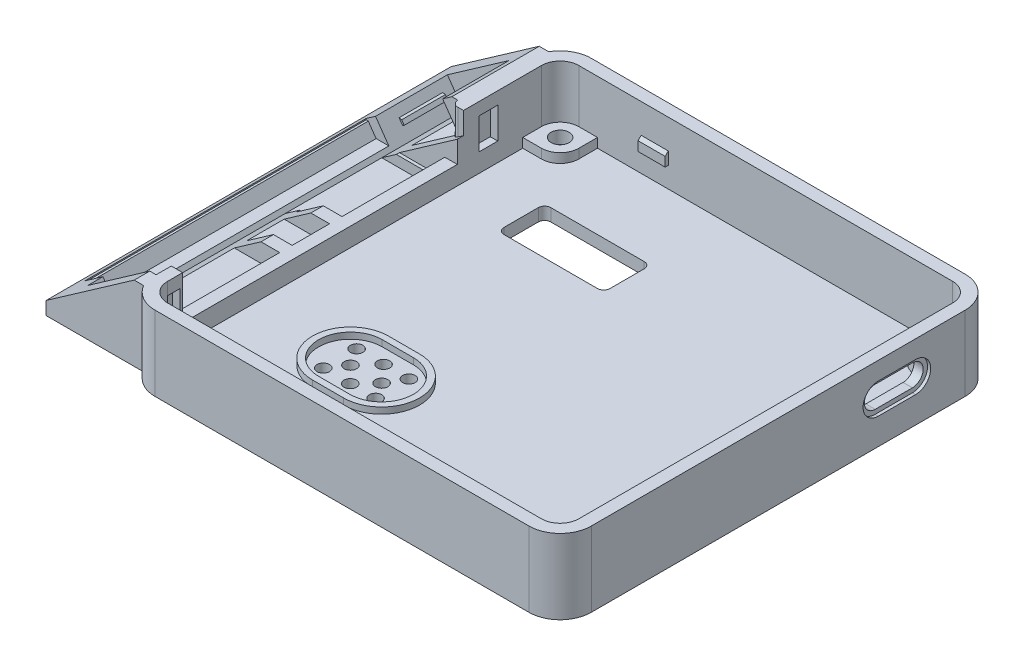
from build123d import *

# Parameters (mm, degrees)
EXTRUDE_1_DEPTH                 = 2
EXTRUDE_2_DEPTH                 = 10
SKETCH_3_W                      = 2
SKETCH_3_H                      = 60
CUT_EXTRUDE_1_DEPTH             = 7
EXTRUDE_3_DEPTH                 = 1.5
SKETCH_5_R                      = 1.45
CUT_EXTRUDE_2_DEPTH             = 2
SKETCH_6_W                      = 15
SKETCH_6_H                      = 60
EXTRUDE_4_DEPTH                 = 1
CUT_EXTRUDE_3_DEPTH             = 4
CUT_EXTRUDE_4_DEPTH             = 0.5
SKETCH_10_W                     = 1.3
SKETCH_10_H                     = 60
EXTRUDE_5_DEPTH                 = 2
EXTRUDE_6_DEPTH                 = 60
CUT_EXTRUDE_5_REACH             = 84.879
CUT_EXTRUDE_5_DIRECTION_2_DEPTH = 83.8794305
SKETCH_13_W                     = 9.618455624
SKETCH_13_H                     = 12
SKETCH_13_H_2                   = 9.5
CUT_EXTRUDE_6_DEPTH             = 3
SKETCH_14_W                     = 2.5
SKETCH_14_H                     = 12
EXTRUDE_7_DEPTH                 = 16
CUT_EXTRUDE_7_DEPTH             = 56
CUT_EXTRUDE_8_DEPTH             = 9
CUT_EXTRUDE_9_REACH             = 86.854
EXTRUDE_11_REACH                = 69.777
SKETCH_18_W                     = 3.617665378
SKETCH_18_H                     = 2.486750252
SKETCH_18_W_2                   = 13.966175107
SKETCH_18_H_2                   = 1.144037097
SKETCH_20_W                     = 1.83009778
SKETCH_20_H                     = 2.431652405
EXTRUDE_12_DEPTH                = 7
SKETCH_21_W                     = 31.175621826
SKETCH_21_H                     = 21.420158012
CUT_EXTRUDE_10_DEPTH            = 65
EXTRUDE_14_REACH                = 69.777
SKETCH_22_W                     = 2.262350427
SKETCH_22_H                     = 11.841336359
EXTRUDE_15_DEPTH                = 2
EXTRUDE_START                   = -30
EXTRUDE_16_DEPTH                = 11.523748541
SKETCH_25_W                     = 9.173589302
SKETCH_25_H                     = 3.581253289
CUT_EXTRUDE_11_DEPTH            = 18
EXTRUDE_17_DEPTH                = 1.115472511
SKETCH_27_W                     = 3
SKETCH_27_H                     = 5
CUT_EXTRUDE_12_DEPTH            = 1.2
SKETCH_29_W                     = 3
SKETCH_29_H                     = 5
SKETCH_29_W_2                   = 2
CUT_EXTRUDE_13_DEPTH            = 1.2
SKETCH_30_W                     = 7.618455624
SKETCH_30_H                     = 15.5
CUT_EXTRUDE_14_DEPTH            = 1.634293
EXTRUDE_18_DEPTH                = 2
CUT_EXTRUDE_15_DEPTH            = 7
SKETCH_33_W                     = 4.353731563
SKETCH_33_H                     = 2
EXTRUDE_19_DEPTH                = 0.5
CHAMFER_1_SIZE                  = 0.5
SKETCH_34_W                     = 5.726465504
SKETCH_34_H                     = 2
EXTRUDE_20_DEPTH                = 0.5
CHAMFER_2_SIZE                  = 0.5
SKETCH_35_W                     = 17
SKETCH_35_H                     = 7.5
CUT_EXTRUDE_16_DEPTH            = 2
EXTRUDE_21_DEPTH                = 1
SKETCH_37_R                     = 1
CUT_EXTRUDE_17_DEPTH            = 2
FILLET_1_R                      = 1
SKETCH_38_W                     = 7
SKETCH_38_H                     = 1
EXTRUDE_22_DEPTH                = 0.3
SKETCH_39_W                     = 7
SKETCH_39_H                     = 1
EXTRUDE_23_DEPTH                = 0.3
CHAMFER_3_SIZE                  = 0.3


# Read off the part's stored shape, not the designer's step: 凸台-拉伸16
with BuildPart() as part:
    # 草图1 → 凸台-拉伸1 (new body)
    with BuildSketch(Plane(origin=(0, 0, 0), x_dir=(1, 0, 0), z_dir=(0, 1, 0))):
        with BuildLine():
            Line((-30, -35), (30, -35))
            ThreePointArc((30, -35), (33.535533906, -33.535533906), (35, -30))
            Line((35, -30), (35, 30))
            ThreePointArc((35, 30), (33.535533906, 33.535533906), (30, 35))
            Line((30, 35), (-30, 35))
            ThreePointArc((-30, 35), (-33.535533906, 33.535533906), (-35, 30))
            Line((-35, 30), (-35, -30))
            ThreePointArc((-35, -30), (-33.535533906, -33.535533906), (-30, -35))
        make_face()
    extrude(amount=EXTRUDE_1_DEPTH)

    # 草图2 → 凸台-拉伸2 (add)
    with BuildSketch(Plane(origin=(0, 2, 0), x_dir=(1, 0, 0), z_dir=(0, 1, 0))):
        with BuildLine():
            Line((-30, -35), (30, -35))
            ThreePointArc((30, -35), (33.535533906, -33.535533906), (35, -30))
            Line((35, -30), (35, 30))
            ThreePointArc((35, 30), (33.535533906, 33.535533906), (30, 35))
            Line((30, 35), (-30, 35))
            ThreePointArc((-30, 35), (-33.535533906, 33.535533906), (-35, 30))
            Line((-35, 30), (-35, -30))
            ThreePointArc((-35, -30), (-33.535533906, -33.535533906), (-30, -35))
        make_face()
        with BuildLine():
            Line((-33, -30), (-33, 30))
            ThreePointArc((-33, 30), (-32.121320344, 32.121320344), (-30, 33))
            Line((-30, 33), (30, 33))
            ThreePointArc((30, 33), (32.121320344, 32.121320344), (33, 30))
            Line((33, 30), (33, -30))
            ThreePointArc((33, -30), (32.121320344, -32.121320344), (30, -33))
            Line((30, -33), (-30, -33))
            ThreePointArc((-30, -33), (-32.121320344, -32.121320344), (-33, -30))
        make_face(mode=Mode.SUBTRACT)
    extrude(amount=EXTRUDE_2_DEPTH)

    # 草图3 → 切除-拉伸1 (cut)
    with BuildSketch(Plane(origin=(0, 12, 0), x_dir=(1, 0, 0), z_dir=(0, 1, 0))):
        with Locations((-34, 0)):
            Rectangle(SKETCH_3_W, SKETCH_3_H)
    extrude(amount=-CUT_EXTRUDE_1_DEPTH, mode=Mode.SUBTRACT)

    # 草图4 → 凸台-拉伸3 (add)
    with BuildSketch(Plane(origin=(0, 2, 0), x_dir=(1, 0, 0), z_dir=(0, 1, 0))):
        with BuildLine():
            Line((-27, 30), (-27, 33))
            Line((-27, 33), (-30, 33))
            ThreePointArc((-30, 33), (-32.121320344, 32.121320344), (-33, 30))
            Line((-33, 30), (-33, 27))
            Line((-33, 27), (-30, 27))
            ThreePointArc((-30, 27), (-27.878679656, 27.878679656), (-27, 30))
        make_face()
        with BuildLine():
            Line((27, 30), (27, 33))
            Line((27, 33), (30, 33))
            ThreePointArc((30, 33), (32.121320344, 32.121320344), (33, 30))
            Line((33, 30), (33, 27))
            Line((33, 27), (30, 27))
            ThreePointArc((30, 27), (27.878679656, 27.878679656), (27, 30))
        make_face()
        with BuildLine():
            Line((-33, -27), (-33, -30))
            ThreePointArc((-33, -30), (-32.121320344, -32.121320344), (-30, -33))
            Line((-30, -33), (-27, -33))
            Line((-27, -33), (-27, -30))
            ThreePointArc((-27, -30), (-27.878679656, -27.878679656), (-30, -27))
            Line((-30, -27), (-33, -27))
        make_face()
        with BuildLine():
            Line((33, -30), (33, -27))
            Line((33, -27), (30, -27))
            ThreePointArc((30, -27), (27.878679656, -27.878679656), (27, -30))
            Line((27, -30), (27, -33))
            Line((27, -33), (30, -33))
            ThreePointArc((30, -33), (32.121320344, -32.121320344), (33, -30))
        make_face()
    extrude(amount=EXTRUDE_3_DEPTH)

    # 草图5 → 切除-拉伸2 (cut)
    with BuildSketch(Plane(origin=(0, 3.5, 0), x_dir=(1, 0, 0), z_dir=(0, 1, 0))):
        with Locations(Location((30, -30, 0), (0, 0, 270))):
            Circle(SKETCH_5_R)
        with Locations(Location((30, 30, 0), (0, 0, 270))):
            Circle(SKETCH_5_R)
        with Locations(Location((-30, 30, 0), (0, 0, 270))):
            Circle(SKETCH_5_R)
        with Locations(Location((-30, -30, 0), (0, 0, 270))):
            Circle(SKETCH_5_R)
    extrude(amount=-CUT_EXTRUDE_2_DEPTH, mode=Mode.SUBTRACT)

    # 草图6 → 凸台-拉伸4 (add)
    with BuildSketch(Plane.XZ):
        with Locations((-42.5, 0)):
            Rectangle(SKETCH_6_W, SKETCH_6_H)
    extrude(amount=-EXTRUDE_4_DEPTH)

    # 草图8 → 切除-拉伸3 (cut)
    with BuildSketch(Plane.ZY.offset(-33)):
        with BuildLine():
            Line((-22.024936323, 8.41519065), (-16.057099874, 8.41519065))
            ThreePointArc((-16.057099874, 8.41519065), (-14.319259233, 6.677350008), (-16.057099874, 4.939509367))
            Line((-16.057099874, 4.939509367), (-22.024936323, 4.939509367))
            ThreePointArc((-22.024936323, 4.939509367), (-23.762776965, 6.677350008), (-22.024936323, 8.41519065))
        make_face()
    extrude(amount=-CUT_EXTRUDE_3_DEPTH, mode=Mode.SUBTRACT)

    # 草图9 → 切除-拉伸4 (cut)
    with BuildSketch(Plane(origin=(35, 0, 0), x_dir=(0, 0, -1), z_dir=(1, 0, 0))):
        with BuildLine():
            Line((16.057099874, 9.11519065), (22.024936323, 9.11519065))
            ThreePointArc((22.024936323, 9.11519065), (24.462776965, 6.677350008), (22.024936323, 4.239509367))
            Line((22.024936323, 4.239509367), (16.057099874, 4.239509367))
            ThreePointArc((16.057099874, 4.239509367), (13.619259233, 6.677350008), (16.057099874, 9.11519065))
        make_face()
    extrude(amount=-CUT_EXTRUDE_4_DEPTH, mode=Mode.SUBTRACT)

    # 草图10 → 凸台-拉伸5 (add)
    with BuildSketch(Plane(origin=(0, 1, 0), x_dir=(1, 0, 0), z_dir=(0, 1, 0))):
        with Locations((-49.35, 0)):
            Rectangle(SKETCH_10_W, SKETCH_10_H)
    extrude(amount=EXTRUDE_5_DEPTH)

    # 草图11 → 凸台-拉伸6 (add)
    with BuildSketch(Plane.XY.offset(30)):
        Polygon((-43.712592027, 1), (-38, 5), (-35, 5), (-35, 1), align=None)
        Polygon((-48.7, 2.8), (-48.360373569, 2.8), (-47.1, 1), (-48.7, 1), align=None)
    extrude(amount=-EXTRUDE_6_DEPTH)

    # 草图12 → 切除-拉伸5 (cut, up to next)
    with BuildSketch(Plane.XY.offset(30), mode=Mode.PRIVATE) as cut_extrude_5_sk1:
        Polygon((-45.062592027, 1), (-44.618455624, 0.365707481), (-43.712592027, 1), align=None)
    cut_extrude_5_tool1 = extrude(cut_extrude_5_sk1.sketch, amount=-CUT_EXTRUDE_5_REACH, mode=Mode.PRIVATE) & part.part
    add(cut_extrude_5_tool1.solids().sort_by_distance((-44.464547, 0.788569, 30))[0], mode=Mode.SUBTRACT)

    # 草图12 → 切除-拉伸5 direction 2 (cut)
    with BuildSketch(Plane.XY.offset(30)):
        Polygon((-45.062592027, 1), (-44.618455624, 0.365707481), (-43.712592027, 1), align=None)
    extrude(amount=CUT_EXTRUDE_5_DIRECTION_2_DEPTH, mode=Mode.SUBTRACT)

    # 草图13 → 切除-拉伸6 (cut)
    with BuildSketch(Plane(origin=(0, 5, 0), x_dir=(1, 0, 0), z_dir=(0, 1, 0))):
        with Locations((-39.809227812, -22)):
            Rectangle(SKETCH_13_W, SKETCH_13_H)
        with Locations((-39.809227812, -8)):
            Rectangle(SKETCH_13_W, SKETCH_13_H)
        Polygon((-35, 12), (-35, 0), (-44.618455624, 0), (-44.618455624, 12), (-44.618455624, 16.5), (-35, 16.5), align=None)
        with Locations((-39.809227812, 23.25)):
            Rectangle(SKETCH_13_W, SKETCH_13_H_2)
    extrude(amount=-CUT_EXTRUDE_6_DEPTH, mode=Mode.SUBTRACT)

    # 草图14 → 凸台-拉伸7 (add)
    with BuildSketch(Plane.ZY.offset(50)):
        with Locations((-31.25, 6)):
            Rectangle(SKETCH_14_W, SKETCH_14_H)
        with Locations((31.25, 6)):
            Rectangle(SKETCH_14_W, SKETCH_14_H)
    extrude(amount=-EXTRUDE_7_DEPTH)

    # 草图15 → 切除-拉伸7 (cut, symmetric)
    with BuildSketch(Plane(origin=(0, 0, 30), x_dir=(-1, 0, 0), z_dir=(0, 0, -1))):
        Polygon((35.846667939, 12), (48.7, 3), (50, 3), (50, 12), align=None)
    extrude(amount=CUT_EXTRUDE_7_DEPTH, both=True, mode=Mode.SUBTRACT)

    # 草图16 → 切除-拉伸8 (cut, symmetric)
    with BuildSketch(Plane.XY.offset(-30)):
        Polygon((-50, 3), (-48.7, 3), (-35.846667939, 12), (-50, 12), align=None)
    extrude(amount=CUT_EXTRUDE_8_DEPTH, both=True, mode=Mode.SUBTRACT)

    # 草图17 → 切除-拉伸9 (cut, up to next)
    with BuildSketch(Plane(origin=(0, 0, -32.5), x_dir=(-1, 0, 0), z_dir=(0, 0, -1)), mode=Mode.PRIVATE) as cut_extrude_9_sk1:
        Polygon((48.7, 3), (50, 2.0897302), (50, 3), align=None)
    cut_extrude_9_tool1 = extrude(cut_extrude_9_sk1.sketch, amount=-CUT_EXTRUDE_9_REACH, mode=Mode.PRIVATE) & part.part
    add(cut_extrude_9_tool1.solids().sort_by_distance((-49.566667, 2.696577, -32.5))[0], mode=Mode.SUBTRACT)

    # 凸台-拉伸11: up to this plane
    extrude_11_end = Plane(origin=(-33, 12, 30), z_dir=(1, 0, 0))
    # 草图18 → 凸台-拉伸11 (add, up to the surface)
    with BuildSketch(Plane(origin=(-17.431348441, 24.894545531, 0), x_dir=(0.8191520442889906, 0.5735764363510479, 0), z_dir=(-0.5735764363510479, 0.8191520442889907, 0)), mode=Mode.PRIVATE) as extrude_11_sk1:
        with Locations((-36.443762979, -28.811722721)):
            Rectangle(SKETCH_18_W, SKETCH_18_H)
    extrude_11_tool1 = split(extrude(extrude_11_sk1.sketch, amount=-EXTRUDE_11_REACH, mode=Mode.PRIVATE), bisect_by=extrude_11_end, keep=Keep.BOTH, mode=Mode.PRIVATE)
    add(extrude_11_tool1.solids().sort_by_distance((-47.284331, 3.991262, 28.811723))[0])
    # 草图18 → 凸台-拉伸11 (add, up to the surface)
    with BuildSketch(Plane(origin=(-17.431348441, 24.894545531, 0), x_dir=(0.8191520442889906, 0.5735764363510479, 0), z_dir=(-0.5735764363510479, 0.8191520442889907, 0)), mode=Mode.PRIVATE) as extrude_11_sk2:
        with Locations((-31.269508115, 29.68749106)):
            Rectangle(SKETCH_18_W_2, SKETCH_18_H_2)
    extrude_11_tool2 = split(extrude(extrude_11_sk2.sketch, amount=-EXTRUDE_11_REACH, mode=Mode.PRIVATE), bisect_by=extrude_11_end, keep=Keep.BOTH, mode=Mode.PRIVATE)
    add(extrude_11_tool2.solids().sort_by_distance((-43.04583, 6.959093, -29.687491))[0])

    # 草图20 → 凸台-拉伸12 (add)
    with BuildSketch(Plane(origin=(0, 5, 0), x_dir=(1, 0, 0), z_dir=(0, 1, 0))):
        with BuildLine():
            Line((-33, 18.5), (-33, 17.5))
            Line((-33, 17.5), (-33.923748541, 17.5))
            ThreePointArc((-33.923748541, 17.5), (-34.614062568, 17.785937432), (-34.9, 18.476251459))
            Line((-34.9, 18.476251459), (-34.9, 30))
            Line((-34.9, 30), (-33, 30))
            Line((-33, 30), (-33, 18.5))
        make_face()
        with Locations((-33.91504889, -28.784173798)):
            Rectangle(SKETCH_20_W, SKETCH_20_H)
    extrude(amount=EXTRUDE_12_DEPTH)

    # 草图21 → 切除-拉伸10 (cut)
    with BuildSketch(Plane.XY.offset(32.5)):
        with Locations((-34.412189087, -10.710079006)):
            Rectangle(SKETCH_21_W, SKETCH_21_H)
    extrude(amount=-CUT_EXTRUDE_10_DEPTH, mode=Mode.SUBTRACT)

    # 凸台-拉伸14: up to this face of the body (flat: up to its plane)
    extrude_14_end = Plane(part.part.faces().sort_by_distance((-7.084186102, 0, 0))[0])
    # 草图22 → 凸台-拉伸14 (add, up to the picked face)
    with BuildSketch(Plane(origin=(-17.431348441, 24.894545531, 0), x_dir=(0.8191520442889906, 0.5735764363510479, 0), z_dir=(-0.5735764363510479, 0.8191520442889907, 0)), mode=Mode.PRIVATE) as extrude_14_sk1:
        with Locations((-37.470713158, 23.498752413)):
            Rectangle(SKETCH_22_W, SKETCH_22_H)
    extrude_14_tool1 = split(extrude(extrude_14_sk1.sketch, amount=-EXTRUDE_14_REACH, mode=Mode.PRIVATE), bisect_by=extrude_14_end, keep=Keep.BOTH, mode=Mode.PRIVATE)
    add(extrude_14_tool1.solids().sort_by(Axis((-48.12556, 3.402227, -23.498752), (0.5735764363510479, -0.8191520442889907, 0)))[0])

    # 草图23 → 凸台-拉伸15 (add)
    with BuildSketch(Plane.XY.offset(-16.5)):
        Polygon((-38, 5), (-33, 8.501037691), (-33, 5), align=None)
    extrude(amount=-EXTRUDE_15_DEPTH)

    # 凸台-拉伸16 outline → 凸台-拉伸16 (add)
    with BuildSketch(Plane.XY.offset(EXTRUDE_START)):
        Polygon((-35.211444218, 12.444788438), (-37.325619492, 10.964426974), (-34.9, 7.500283331), (-34.9, 12), align=None)
    extrude(amount=EXTRUDE_16_DEPTH)

    # 草图25 → 切除-拉伸11 (cut)
    with BuildSketch(Plane(origin=(0, 0, -35), x_dir=(-1, 0, 0), z_dir=(0, 0, -1))):
        with Locations((33.784128918, 13.790626645)):
            Rectangle(SKETCH_25_W, SKETCH_25_H)
    extrude(amount=-CUT_EXTRUDE_11_DEPTH, mode=Mode.SUBTRACT)

    # 草图26 → 凸台-拉伸17 (add)
    with BuildSketch(Plane.XY.offset(-29.115472511)):
        Polygon((-38, 5), (-34.9, 7.170643368), (-34.9, 5), align=None)
    extrude(amount=EXTRUDE_17_DEPTH)

    # 草图27 → 切除-拉伸12 (cut)
    with BuildSketch(Plane.ZY.offset(-33)):
        with Locations((-11, 7.5)):
            Rectangle(SKETCH_27_W, SKETCH_27_H)
        with Locations((5.5, 7.5)):
            Rectangle(SKETCH_27_W, SKETCH_27_H)
    extrude(amount=-CUT_EXTRUDE_12_DEPTH, mode=Mode.SUBTRACT)

    # 草图29 → 切除-拉伸13 (cut)
    with BuildSketch(Plane(origin=(-33, 0, 0), x_dir=(0, 0, -1), z_dir=(1, 0, 0))):
        with Locations((21.5, 7.5)):
            Rectangle(SKETCH_29_W, SKETCH_29_H)
        with Locations((-29, 7.5)):
            Rectangle(SKETCH_29_W_2, SKETCH_29_H)
    extrude(amount=-CUT_EXTRUDE_13_DEPTH, mode=Mode.SUBTRACT)

    # 草图30 → 切除-拉伸14 (cut)
    with BuildSketch(Plane(origin=(0, 2, 0), x_dir=(1, 0, 0), z_dir=(0, 1, 0))):
        with Locations((-40.809227812, 8.25)):
            Rectangle(SKETCH_30_W, SKETCH_30_H)
    extrude(amount=-CUT_EXTRUDE_14_DEPTH, mode=Mode.SUBTRACT)

    # 草图31 → 凸台-拉伸18 (add)
    with BuildSketch(Plane.XY.offset(8)):
        Polygon((-42.28444402, 2), (-38, 5), (-35, 5), (-35, 2), align=None)
    extrude(amount=EXTRUDE_18_DEPTH)

    # 草图32 → 切除-拉伸15 (cut)
    with BuildSketch(Plane.XY.offset(10)):
        Polygon((-38, 5), (-35, 5), (-35, 2), (-42.28444402, 2), align=None)
    extrude(amount=CUT_EXTRUDE_15_DEPTH, mode=Mode.SUBTRACT)

    # 草图33 → 凸台-拉伸19 (add)
    with BuildSketch(Plane.XY.offset(-33)):
        with Locations((-17.823134219, 6.3)):
            Rectangle(SKETCH_33_W, SKETCH_33_H)
    extrude(amount=EXTRUDE_19_DEPTH)

    # 倒角1
    chamfer_1_edges = [part.edges().sort_by_distance(p)[0] for p in [
        (-17.823134219, 7.3, -32.5),
    ]]
    chamfer(chamfer_1_edges, length=CHAMFER_1_SIZE - 0.0001)  # a hair under: the kernel refuses the full size

    # 草图34 → 凸台-拉伸20 (add)
    with BuildSketch(Plane(origin=(0, 0, 33), x_dir=(-1, 0, 0), z_dir=(0, 0, -1))):
        with Locations((17.136767248, 6.3)):
            Rectangle(SKETCH_34_W, SKETCH_34_H)
    extrude(amount=EXTRUDE_20_DEPTH)

    # 倒角2
    chamfer_2_edges = [part.edges().sort_by_distance(p)[0] for p in [
        (-17.136767248, 7.3, 32.5),
    ]]
    chamfer(chamfer_2_edges, length=CHAMFER_2_SIZE - 0.0001)  # a hair under: the kernel refuses the full size

    # 草图35 → 切除-拉伸16 (cut)
    with BuildSketch(Plane(origin=(0, 2, 0), x_dir=(1, 0, 0), z_dir=(0, 1, 0))):
        with Locations((-15, 17.25)):
            Rectangle(SKETCH_35_W, SKETCH_35_H)
    extrude(amount=-CUT_EXTRUDE_16_DEPTH, mode=Mode.SUBTRACT)

    # 草图36 → 凸台-拉伸21 (add)
    with BuildSketch(Plane(origin=(0, 2, 0), x_dir=(1, 0, 0), z_dir=(0, 1, 0))):
        with BuildLine():
            Line((-16.671301687, -10.872811799), (-11.671301687, -10.872811799))
            ThreePointArc((-11.671301687, -10.872811799), (-5.571301687, -16.972811799), (-11.671301687, -23.072811799))
            Line((-11.671301687, -23.072811799), (-16.671301687, -23.072811799))
            ThreePointArc((-16.671301687, -23.072811799), (-22.771301687, -16.972811799), (-16.671301687, -10.872811799))
        make_face()
        with BuildLine():
            Line((-16.671301687, -11.872811799), (-11.671301687, -11.872811799))
            ThreePointArc((-11.671301687, -11.872811799), (-6.571301687, -16.972811799), (-11.671301687, -22.072811799))
            Line((-11.671301687, -22.072811799), (-16.671301687, -22.072811799))
            ThreePointArc((-16.671301687, -22.072811799), (-21.771301687, -16.972811799), (-16.671301687, -11.872811799))
        make_face(mode=Mode.SUBTRACT)
    extrude(amount=EXTRUDE_21_DEPTH)

    # 草图37 → 切除-拉伸17 (cut)
    with BuildSketch(Plane(origin=(0, 2, 0), x_dir=(1, 0, 0), z_dir=(0, 1, 0))):
        with Locations(Location((-11.671301687, -16.972811799, 0), (0, 0, 270))):
            Circle(SKETCH_37_R)
        with Locations(Location((-16.671301687, -16.972811799, 0), (0, 0, 270))):
            Circle(SKETCH_37_R)
        with Locations(Location((-14.125513779, -14.204392542, 0), (0, 0, 270))):
            Circle(SKETCH_37_R)
        with Locations(Location((-18.451136058, -14.204392542, 0), (0, 0, 270))):
            Circle(SKETCH_37_R)
        with Locations(Location((-10.056496213, -14.204392542, 0), (0, 0, 270))):
            Circle(SKETCH_37_R)
        with Locations(Location((-18.451136058, -19.556433666, 0), (0, 0, 270))):
            Circle(SKETCH_37_R)
        with Locations(Location((-14.125513779, -19.556433666, 0), (0, 0, 270))):
            Circle(SKETCH_37_R)
        with Locations(Location((-10.056496213, -19.556433666, 0), (0, 0, 270))):
            Circle(SKETCH_37_R)
    extrude(amount=-CUT_EXTRUDE_17_DEPTH, mode=Mode.SUBTRACT)

    # 圆角1
    fillet_1_edges = [part.edges().sort_by_distance(p)[0] for p in [
        (-6.5, 1, -21),
        (-6.5, 1, -13.5),
        (-23.5, 1, -13.5),
        (-23.5, 1, -21),
    ]]
    fillet(fillet_1_edges, radius=FILLET_1_R)

    # 草图38 → 凸台-拉伸22 (add)
    with BuildSketch(Plane(origin=(-29.767606795, -20.843502672, 0), x_dir=(0, 0, -1), z_dir=(0.819152044288996, 0.5735764363510403, 0))):
        with Locations((24, 28.390628583)):
            Rectangle(SKETCH_38_W, SKETCH_38_H)
    extrude(amount=EXTRUDE_22_DEPTH)

    # 草图39 → 凸台-拉伸23 (add)
    with BuildSketch(Plane(origin=(-19.894271051, -13.930118557, 0), x_dir=(0, 0, 1), z_dir=(-0.8191520442889905, -0.573576436351048, 0))):
        with Locations((-24, 28.390628583)):
            Rectangle(SKETCH_39_W, SKETCH_39_H)
    extrude(amount=EXTRUDE_23_DEPTH)

    # 倒角3
    chamfer_3_edges = [part.edges().sort_by_distance(p)[0] for p in [
        (-36.711000451, 9.563625977, -24),
        (-46.092844968, 2.994387723, -24),
    ]]
    chamfer(chamfer_3_edges, length=CHAMFER_3_SIZE - 0.0001)  # a hair under: the kernel refuses the full size


solid = part.part
